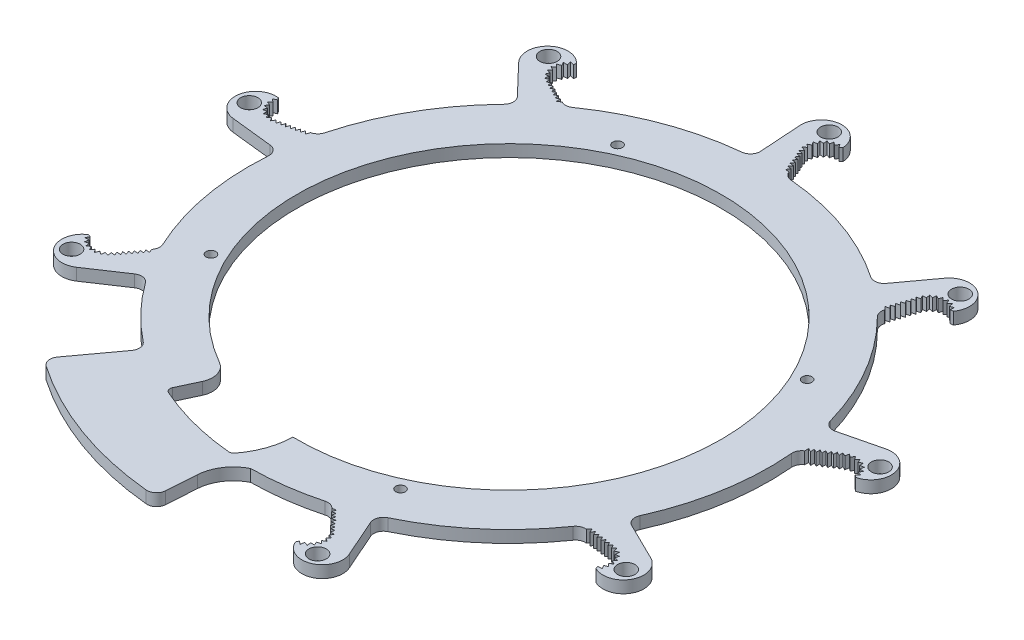
from build123d import *

# Parameters (mm, degrees)
SKETCH1_R           = 68.58
SKETCH1_R_2         = 55.88
BOSS_EXTRUDE1_DEPTH = 3.175
BOSS_EXTRUDE2_START = -3.175
BOSS_EXTRUDE2_DEPTH = 3.175
CIRPATTERN1_COUNT   = 9
SKETCH4_R           = 1.27
CUT_EXTRUDE1_DEPTH  = 124.088082607
CIRPATTERN14_COUNT  = 4
CUT_EXTRUDE2_DEPTH  = 124.088082607
BOSS_EXTRUDE4_START = -3.175
BOSS_EXTRUDE4_DEPTH = 3.175
CUT_EXTRUDE3_DEPTH  = 124.088082607
CRVPATTERN1_DEPTH   = 3.175
CIRPATTERN15_COUNT  = 9
BOSS_EXTRUDE5_START = -3.175
BOSS_EXTRUDE5_DEPTH = 3.175
CUT_EXTRUDE4_DEPTH  = 124.088082607
CUT_EXTRUDE5_START  = -3.175
CUT_EXTRUDE5_DEPTH  = 3.175
BOSS_EXTRUDE6_START = -3.175
BOSS_EXTRUDE6_DEPTH = 3.175
SKETCH3_R           = 2.286
CUT_EXTRUDE6_DEPTH  = 124.088082607
CIRPATTERN16_COUNT  = 9


# Read off the part's stored shape, not the designer's step: CrvPattern1, Cut-Extrude5
with BuildPart() as part:
    # Sketch1 → Boss-Extrude1 (new body)
    with BuildSketch(Plane(origin=(0, 0, 0), x_dir=(1, 0, 0), z_dir=(0, 1, 0))):
        with Locations(Location((0, 0, 0), (0, 0, 270))):
            Circle(SKETCH1_R)
        with Locations(Location((0, 0, 0), (0, 0, 270))):
            Circle(SKETCH1_R_2, mode=Mode.SUBTRACT)
    extrude(amount=BOSS_EXTRUDE1_DEPTH)

    # Sketch2 → Boss-Extrude2 (add)
    with BuildSketch(Plane(origin=(0, 3.175, 0), x_dir=(1, 0, 0), z_dir=(0, 1, 0)).offset(BOSS_EXTRUDE2_START)):
        with BuildLine():
            Line((-4.648503105, 70.922452149), (-5.367925957, 81.898723786))
            ThreePointArc((-5.367925957, 81.898723786), (0, 87.63), (5.367925957, 81.898723786))
            ThreePointArc((5.367925957, 81.898723786), (1.585103244, 80.66312392), (0.966324082, 76.732021396))
            Line((0.966324082, 76.732021396), (3.81, 69.87951531))
            ThreePointArc((3.81, 69.87951531), (4.65537594, 68.803759817), (5.936157335, 68.322605601))
            ThreePointArc((5.936157335, 68.322605601), (-0.497376724, 68.578196363), (-6.926526743, 68.22931648))
            ThreePointArc((-6.926526743, 68.22931648), (-5.243785443, 69.115963701), (-4.648503105, 70.922452149))
        make_face()
    boss_extrude2 = extrude(amount=BOSS_EXTRUDE2_DEPTH)

    # CirPattern1: Boss-Extrude2 ×9 about axis
    cirpattern1_axis = Axis((0, 0, 0), (0, 1, 0))
    for i in range(1, CIRPATTERN1_COUNT):
        add(boss_extrude2.rotate(cirpattern1_axis, i * 360 / CIRPATTERN1_COUNT))

    # Sketch4 → Cut-Extrude1 (cut, through all)
    with BuildSketch(Plane(origin=(0, 3.175, 0), x_dir=(1, 0, 0), z_dir=(0, 1, 0))):
        with Locations(Location((53.522006363, 24.957721447, 0), (0, 0, 270))):
            Circle(SKETCH4_R)
    cut_extrude1 = extrude(amount=-CUT_EXTRUDE1_DEPTH, mode=Mode.SUBTRACT)

    # CirPattern14: Cut-Extrude1 ×4 about axis
    cirpattern14_axis = Axis((0, 0, 0), (0, 1, 0))
    for i in range(1, CIRPATTERN14_COUNT):
        add(cut_extrude1.rotate(cirpattern14_axis, i * 360 / CIRPATTERN14_COUNT), mode=Mode.SUBTRACT)

    # Sketch5 → Cut-Extrude2 (cut, through all)
    with BuildSketch(Plane(origin=(0, 3.175, 0), x_dir=(1, 0, 0), z_dir=(0, 1, 0))):
        with BuildLine():
            Line((-23.605497969, -50.649332332), (-28.970383871, -62.160544225))
            ThreePointArc((-28.970383871, -62.160544225), (-28.9581278, -62.166254788), (-28.945870603, -62.171962934))
            Line((-28.945870603, -62.171962934), (-37.310710301, -85.683340926))
            Line((-37.310710301, -85.683340926), (-25.04929232, -89.594326826))
            Line((-25.04929232, -89.594326826), (-16.826994534, -66.483596887))
            ThreePointArc((-16.826994534, -66.483596887), (-10.700662367, -67.740034137), (-4.485346603, -68.433164956))
            Line((-4.485346603, -68.433164956), (0, -55.88))
            ThreePointArc((0, -55.88), (-12.089038616, -54.55666362), (-23.605497969, -50.649332332))
        make_face()
    extrude(amount=-CUT_EXTRUDE2_DEPTH, mode=Mode.SUBTRACT)

    # Sketch6 → Boss-Extrude4 (add)
    with BuildSketch(Plane(origin=(0, 3.175, 0), x_dir=(1, 0, 0), z_dir=(0, 1, 0)).offset(BOSS_EXTRUDE4_START)):
        with BuildLine():
            Line((-42.027113518, -57.317750561), (-50.29211617, -68.589791887))
            ThreePointArc((-50.29211617, -68.589791887), (-50.748137704, -70.515542148), (-49.683858722, -72.184008496))
            ThreePointArc((-49.683858722, -72.184008496), (-29.97122516, -82.345264359), (-8.338942392, -87.232327378))
            ThreePointArc((-8.338942392, -87.232327378), (-6.451187896, -86.638313347), (-5.562672252, -84.869978069))
            Line((-5.562672252, -84.869978069), (-4.648503105, -70.922452149))
            ThreePointArc((-4.648503105, -70.922452149), (-3.822519431, -69.209118397), (-2.038443532, -68.54969838))
            ThreePointArc((-2.038443532, -68.54969838), (-4.002415029, -68.463107393), (-5.9630977, -68.320259556))
            Line((-5.9630977, -68.320259556), (-5.796404309, -66.410424047))
            ThreePointArc((-5.796404309, -66.410424047), (-6.254355426, -67.280437742), (-7.196100859, -67.562853384))
            ThreePointArc((-7.196100859, -67.562853384), (-17.571969403, -65.633443581), (-27.523885059, -62.120518158))
            ThreePointArc((-27.523885059, -62.120518158), (-28.198546773, -61.405343615), (-28.160541107, -60.422898388))
            Line((-28.160541107, -60.422898388), (-28.970383871, -62.160544225))
            ThreePointArc((-28.970383871, -62.160544225), (-35.978238446, -58.384781907), (-42.501358426, -53.822401767))
            ThreePointArc((-42.501358426, -53.822401767), (-41.558544014, -55.47432869), (-42.027113518, -57.317750561))
        make_face()
    extrude(amount=BOSS_EXTRUDE4_DEPTH)

    # Sketch8 → Cut-Extrude3 (cut, through all)
    with BuildSketch(Plane(origin=(0, 3.175, 0), x_dir=(1, 0, 0), z_dir=(0, 1, 0))):
        Polygon((3.47094583, 71.027887706), (3.957724412, 69.854880199), (2.775929115, 70.051961086), align=None)
    cut_extrude3 = extrude(amount=-CUT_EXTRUDE3_DEPTH, mode=Mode.SUBTRACT)

    # CrvPattern1 outline → CrvPattern1 (cut)
    with BuildSketch(Plane(origin=(0, 0, 0), x_dir=(1, 0, 0), z_dir=(0, 1, 0))):
        with BuildLine():
            Line((2.954390649, 71.893612642), (2.35875647, 71.057236713))
            Line((2.35875647, 71.057236713), (3.371563294, 70.888337016))
            Line((3.371563294, 70.888337016), (3.38406874, 70.905896878))
            Line((3.38406874, 70.905896878), (0.966324082, 76.732021396))
            ThreePointArc((0.966324082, 76.732021396), (1.585103244, 80.66312392), (5.367925957, 81.898723786))
            ThreePointArc((5.367925957, 81.898723786), (5.37940733, 82.230759048), (5.370370135, 82.562869823))
            Line((5.370370135, 82.562869823), (4.835817307, 82.035720051))
            Line((4.835817307, 82.035720051), (4.241589962, 82.88503055))
            Line((4.241589962, 82.88503055), (3.738556552, 81.978723842))
            Line((3.738556552, 81.978723842), (2.929076067, 82.62616172))
            Line((2.929076067, 82.62616172), (2.701825603, 81.614830079))
            Line((2.701825603, 81.614830079), (1.74270305, 82.007918354))
            Line((1.74270305, 82.007918354), (1.809654933, 80.973533557))
            Line((1.809654933, 80.973533557), (0.778630371, 81.080411122))
            Line((0.778630371, 81.080411122), (1.13435793, 80.106813481))
            Line((1.13435793, 80.106813481), (0.114999311, 79.918817556))
            Line((0.114999311, 79.918817556), (0.73066965, 79.084920383))
            Line((0.73066965, 79.084920383), (-0.194400635, 78.617288659))
            Line((-0.194400635, 78.617288659), (0.631310365, 77.990682079))
            Line((0.631310365, 77.990682079), (-0.124491578, 77.281317657))
            Line((-0.124491578, 77.281317657), (0.859335479, 76.907083655))
            Line((0.859335479, 76.907083655), (0.272893244, 76.083614844))
            Line((0.272893244, 76.083614844), (1.285700068, 75.914715147))
            Line((1.285700068, 75.914715147), (0.690065889, 75.078339218))
            Line((0.690065889, 75.078339218), (1.702872713, 74.909439521))
            Line((1.702872713, 74.909439521), (1.107238535, 74.073063591))
            Line((1.107238535, 74.073063591), (2.120045358, 73.904163894))
            Line((2.120045358, 73.904163894), (1.52441118, 73.067787965))
            Line((1.52441118, 73.067787965), (2.537218003, 72.898888268))
            Line((2.537218003, 72.898888268), (1.941583825, 72.062512339))
            Line((1.941583825, 72.062512339), (2.954390649, 71.893612642))
        make_face()
    crvpattern1 = extrude(amount=CRVPATTERN1_DEPTH, mode=Mode.SUBTRACT)

    # CirPattern15: Cut-Extrude3, CrvPattern1 ×9 about axis, 1 skipped
    cirpattern15_axis = Axis((0, 0, 0), (0, -1, 0))
    add([cut_extrude3.rotate(cirpattern15_axis, i * 360 / CIRPATTERN15_COUNT) for i in range(1, CIRPATTERN15_COUNT) if i not in (5,)], mode=Mode.SUBTRACT)
    add([crvpattern1.rotate(cirpattern15_axis, i * 360 / CIRPATTERN15_COUNT) for i in range(1, CIRPATTERN15_COUNT) if i not in (5,)], mode=Mode.SUBTRACT)

    # Sketch9 → Boss-Extrude5 (add)
    with BuildSketch(Plane(origin=(0, 3.175, 0), x_dir=(1, 0, 0), z_dir=(0, 1, 0)).offset(BOSS_EXTRUDE5_START)):
        with BuildLine():
            Line((2.437451366, -55.826814622), (2.872260393, -65.785578626))
            ThreePointArc((2.872260393, -65.785578626), (2.470842223, -67.270563279), (1.285922329, -68.251522407))
            ThreePointArc((1.285922329, -68.251522407), (-3.14139772, -71.717724997), (-5.047346652, -77.007628764))
            Line((-5.047346652, -77.007628764), (-9.372250914, -76.724159563))
            ThreePointArc((-9.372250914, -76.724159563), (-8.297123344, -72.118548868), (-5.796561109, -68.104232279))
            ThreePointArc((-5.796561109, -68.104232279), (-2.339693144, -62.407846042), (-1.052673795, -55.870083926))
            ThreePointArc((-1.052673795, -55.870083926), (0.692726705, -55.875706078), (2.437451366, -55.826814622))
        make_face()
    extrude(amount=BOSS_EXTRUDE5_DEPTH)

    # Sketch10 → Cut-Extrude4 (cut, through all)
    with BuildSketch(Plane(origin=(0, 3.175, 0), x_dir=(1, 0, 0), z_dir=(0, 1, 0))):
        with BuildLine():
            Line((-23.605497969, -50.649332332), (-25.661881789, -55.061629317))
            ThreePointArc((-25.661881789, -55.061629317), (-25.424739552, -51.377803685), (-27.744169334, -48.506035376))
            ThreePointArc((-27.744169334, -48.506035376), (-25.697188825, -49.620851328), (-23.605497969, -50.649332332))
        make_face()
    extrude(amount=-CUT_EXTRUDE4_DEPTH, mode=Mode.SUBTRACT)

    # Cut-Extrude5 outline → Cut-Extrude5 (cut)
    with BuildSketch(Plane(origin=(0, 3.175, 0), x_dir=(1, 0, 0), z_dir=(0, 1, 0)).offset(CUT_EXTRUDE5_START)):
        with BuildLine():
            ThreePointArc((-7.196100859, -67.562853385), (-6.674505232, -67.616373793), (-6.152512121, -67.665867464))
            ThreePointArc((-6.152512121, -67.665867464), (-6.029136144, -67.671057274), (-5.905839353, -67.664240602))
            Line((-5.905839353, -67.664240602), (-5.796404309, -66.410424047))
            ThreePointArc((-5.796404309, -66.410424047), (-6.254355426, -67.280437742), (-7.196100859, -67.562853385))
        make_face()
    extrude(amount=CUT_EXTRUDE5_DEPTH, mode=Mode.SUBTRACT)

    # Sketch11<3> → Boss-Extrude6 (add)
    with BuildSketch(Plane(origin=(0, 3.175, 0), x_dir=(1, 0, 0), z_dir=(0, 1, 0)).offset(BOSS_EXTRUDE6_START)):
        with BuildLine():
            Line((-5.905839353, -67.664240602), (-5.960847469, -68.294478268))
            ThreePointArc((-5.960847469, -68.294478268), (-5.879116711, -68.198999128), (-5.796561109, -68.104232279))
            ThreePointArc((-5.796561109, -68.104232279), (-5.407332956, -67.647008218), (-5.032686718, -67.177761381))
            ThreePointArc((-5.032686718, -67.177761381), (-5.419391943, -67.51051165), (-5.905839353, -67.664240602))
        make_face()
    extrude(amount=BOSS_EXTRUDE6_DEPTH)

    # Sketch3 → Cut-Extrude6 (cut, through all)
    with BuildSketch(Plane(origin=(0, 3.175, 0), x_dir=(1, 0, 0), z_dir=(0, 1, 0))):
        with Locations(Location((0, 84.328, 0), (0, 0, 270))):
            Circle(SKETCH3_R)
    cut_extrude6 = extrude(amount=-CUT_EXTRUDE6_DEPTH, mode=Mode.SUBTRACT)

    # CirPattern16: Cut-Extrude6 ×9 about axis, 1 skipped
    cirpattern16_axis = Axis((0, 0, 0), (0, -1, 0))
    add([cut_extrude6.rotate(cirpattern16_axis, i * 360 / CIRPATTERN16_COUNT) for i in range(1, CIRPATTERN16_COUNT) if i not in (5,)], mode=Mode.SUBTRACT)


solid = part.part
